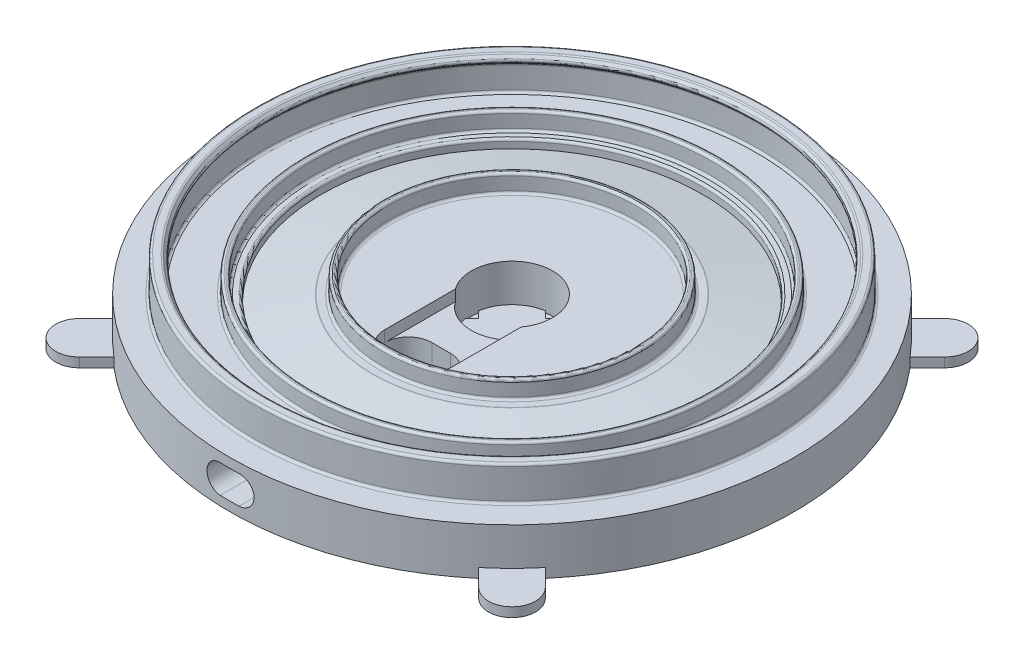
from build123d import *

# Parameters (mm, degrees)
SKETCH1_R               = 60
BOSS_EXTRUDE1_DEPTH     = 10
SKETCH3_R               = 43.75
SKETCH3_R_2             = 42.5
SKETCH3_R_3             = 27.5
SKETCH3_R_4             = 26.25
BOSS_EXTRUDE2_DEPTH     = 3.723
FILLET1_R               = 0.5
FILLET2_R               = 0.5
SKETCH6_R               = 8.625
CUT_EXTRUDE1_DEPTH      = 8.354
SKETCH9_W               = 14
SKETCH9_H               = 15
CUT_EXTRUDE2_DEPTH      = 2.354
CUT_EXTRUDE3_DEPTH      = 10
CUT_EXTRUDE4_DEPTH      = 2
CUT_EXTRUDE4_DEPTH_BACK = 40
BOSS_EXTRUDE3_DEPTH     = 2


with BuildPart() as part:
    # Sketch1 → Boss-Extrude1 (new body)
    with BuildSketch(Plane(origin=(0, 0, 0), x_dir=(1, 0, 0), z_dir=(0, 1, 0))):
        Circle(SKETCH1_R)
    extrude(amount=BOSS_EXTRUDE1_DEPTH)

    # Sketch2 → Cut-Revolve1 (revolve, cut)
    with BuildSketch(Plane.XY):
        Polygon((-29.5, 10), (-40.5, 8.127), (-40.5, 10), align=None)
    revolve(axis=Axis((0, 10, 0), (0, -1, 0)), mode=Mode.SUBTRACT)

    # Sketch3 → Boss-Extrude2 (add)
    # profile 1 of 2: a face of its own
    with BuildSketch(Plane(origin=(0, 10, 0), x_dir=(1, 0, 0), z_dir=(0, 1, 0))):
        Circle(SKETCH3_R)
        Circle(SKETCH3_R_2, mode=Mode.SUBTRACT)
    # profile 2 of 2: a face of its own
    with BuildSketch(Plane(origin=(0, 10, 0), x_dir=(1, 0, 0), z_dir=(0, 1, 0))):
        Circle(SKETCH3_R_3)
        Circle(SKETCH3_R_4, mode=Mode.SUBTRACT)
    extrude(amount=BOSS_EXTRUDE2_DEPTH)

    # Fillet1
    fillet1_edges = [part.edges().sort_by_distance(p)[0] for p in [
        (-26.25, 10, 0),
        (-27.5, 10, 0),
        (-43.75, 10, 0),
        (-42.5, 10, 0),
        (40.5, 10, 0),
        (-27.5, 13.723, 0),
        (-26.25, 13.723, 0),
        (-43.75, 13.723, 0),
        (-42.5, 13.723, 0),
        (29.5, 10, 0),
    ]]
    fillet(fillet1_edges, radius=FILLET1_R)

    # Sketch5 → Revolve1 (revolve)
    with BuildSketch(Plane.XY):
        Polygon((-52.5, 10), (-54.5, 10), (-54.5, 17.323), (-52.5, 17.323), (-51.5, 16.323), (-52.5, 15.323), align=None)
    revolve(axis=Axis((0, 10, 0), (0, 1, 0)))

    # Fillet2
    fillet2_edges = [part.edges().sort_by_distance(p)[0] for p in [
        (52.5, 10, 0),
        (52.5, 15.323, 0),
        (52.5, 17.323, 0),
        (51.5, 16.323, 0),
        (54.5, 10, 0),
        (54.5, 17.323, 0),
    ]]
    fillet(fillet2_edges, radius=FILLET2_R)

    # Sketch6 → Cut-Extrude1 (cut)
    with BuildSketch(Plane(origin=(0, 10, 0), x_dir=(1, 0, 0), z_dir=(0, 1, 0))):
        Circle(SKETCH6_R)
    extrude(amount=-CUT_EXTRUDE1_DEPTH, mode=Mode.SUBTRACT)

    # Sketch9 → Cut-Extrude2 (cut)
    with BuildSketch(Plane(origin=(0, 10, 0), x_dir=(1, 0, 0), z_dir=(0, 1, 0))):
        with Locations((0, -12.538911093)):
            Rectangle(SKETCH9_W, SKETCH9_H)
    extrude(amount=-CUT_EXTRUDE2_DEPTH, mode=Mode.SUBTRACT)

    # Sketch10 → Cut-Extrude3 (cut)
    with BuildSketch(Plane(origin=(0, 10, 0), x_dir=(1, 0, 0), z_dir=(0, 1, 0))):
        with BuildLine():
            Line((2, -25.038911093), (-2, -25.038911093))
            ThreePointArc((-2, -25.038911093), (-7, -20.038911093), (-2, -15.038911093))
            Line((-2, -15.038911093), (2, -15.038911093))
            ThreePointArc((2, -15.038911093), (7, -20.038911093), (2, -25.038911093))
        make_face()
    extrude(amount=-CUT_EXTRUDE3_DEPTH, mode=Mode.SUBTRACT)

    # Sketch11 → Cut-Extrude4 (cut, two sides: drawn at the far end of the back side and taken through both)
    with BuildSketch(Plane(origin=(0, 0, 25.038911093), x_dir=(-1, 0, 0), z_dir=(0, 0, -1)).offset(-CUT_EXTRUDE4_DEPTH_BACK)):
        with BuildLine():
            Line((-2, 8), (2, 8))
            ThreePointArc((2, 8), (5, 5), (2, 2))
            Line((2, 2), (-2, 2))
            ThreePointArc((-2, 2), (-5, 5), (-2, 8))
        make_face()
    extrude(amount=CUT_EXTRUDE4_DEPTH + CUT_EXTRUDE4_DEPTH_BACK, mode=Mode.SUBTRACT)

    # Sketch12 → Boss-Extrude3 (add)
    with BuildSketch(Plane.XZ):
        with BuildLine():
            Line((-49.497474683, -42.426406871), (42.426406871, 49.497474683))
            ThreePointArc((42.426406871, 49.497474683), (49.497474683, 49.497474683), (49.497474683, 42.426406871))
            Line((49.497474683, 42.426406871), (-42.426406871, -49.497474683))
            ThreePointArc((-42.426406871, -49.497474683), (-49.497474683, -49.497474683), (-49.497474683, -42.426406871))
        make_face()
        with BuildLine():
            Line((42.426406871, -49.497474683), (-49.497474683, 42.426406871))
            ThreePointArc((-49.497474683, 42.426406871), (-49.497474683, 49.497474683), (-42.426406871, 49.497474683))
            Line((-42.426406871, 49.497474683), (49.497474683, -42.426406871))
            ThreePointArc((49.497474683, -42.426406871), (49.497474683, -49.497474683), (42.426406871, -49.497474683))
        make_face()
    extrude(amount=-BOSS_EXTRUDE3_DEPTH)


solid = part.part
